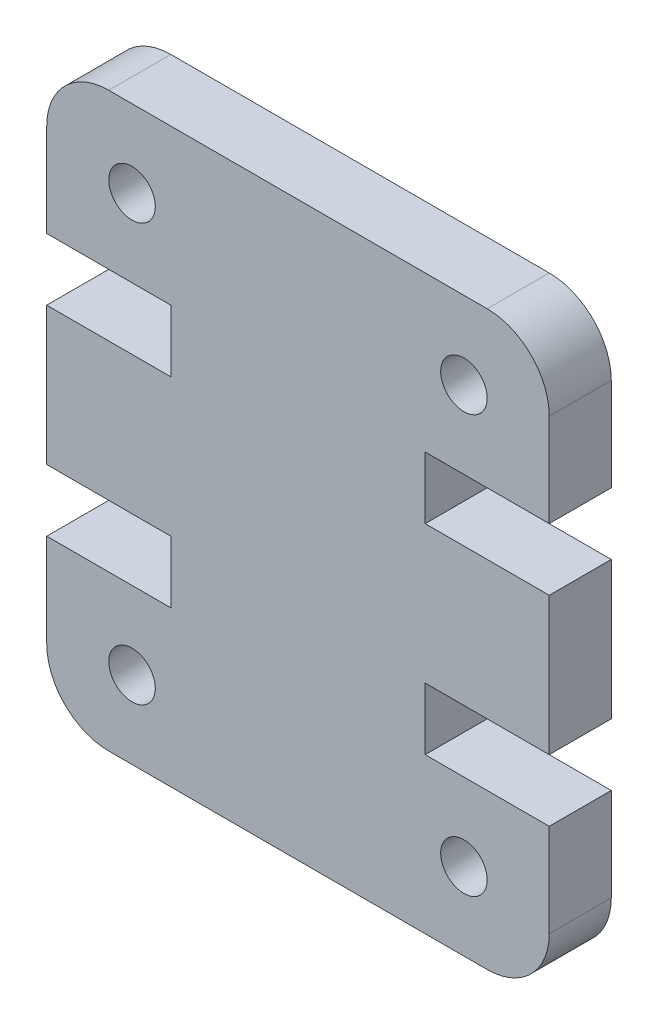
from build123d import *

# Parameters (mm, degrees)
SKETCH2_R           = 0.75
BOSS_EXTRUDE1_DEPTH = 2


with BuildPart() as part:
    # Sketch2 → Boss-Extrude1 (new body)
    with BuildSketch(Plane.XY):
        with BuildLine():
            Line((2, 18.45), (14.2, 18.45))
            ThreePointArc((14.2, 18.45), (15.614213562, 17.864213562), (16.2, 16.45))
            Line((16.2, 16.45), (16.2, 13.45))
            Line((16.2, 13.45), (12.2, 13.45))
            Line((12.2, 13.45), (12.2, 11.45))
            Line((12.2, 11.45), (16.2, 11.45))
            Line((16.2, 11.45), (16.2, 7))
            Line((16.2, 7), (12.2, 7))
            Line((12.2, 7), (12.2, 5))
            Line((12.2, 5), (16.2, 5))
            Line((16.2, 5), (16.2, 2))
            ThreePointArc((16.2, 2), (15.614213562, 0.585786438), (14.2, 0))
            Line((14.2, 0), (2, 0))
            ThreePointArc((2, 0), (0.585786438, 0.585786438), (0, 2))
            Line((0, 2), (0, 5))
            Line((0, 5), (4, 5))
            Line((4, 5), (4, 7))
            Line((4, 7), (0, 7))
            Line((0, 7), (0, 11.45))
            Line((0, 11.45), (4, 11.45))
            Line((4, 11.45), (4, 13.45))
            Line((4, 13.45), (0, 13.45))
            Line((0, 13.45), (0, 16.45))
            ThreePointArc((0, 16.45), (0.585786438, 17.864213562), (2, 18.45))
        make_face()
        with Locations((13.45, 2.5)):
            Circle(SKETCH2_R, mode=Mode.SUBTRACT)
        with Locations((2.75, 2.5)):
            Circle(SKETCH2_R, mode=Mode.SUBTRACT)
        with Locations((13.45, 15.95)):
            Circle(SKETCH2_R, mode=Mode.SUBTRACT)
        with Locations((2.75, 15.95)):
            Circle(SKETCH2_R, mode=Mode.SUBTRACT)
    extrude(amount=BOSS_EXTRUDE1_DEPTH)


solid = part.part
